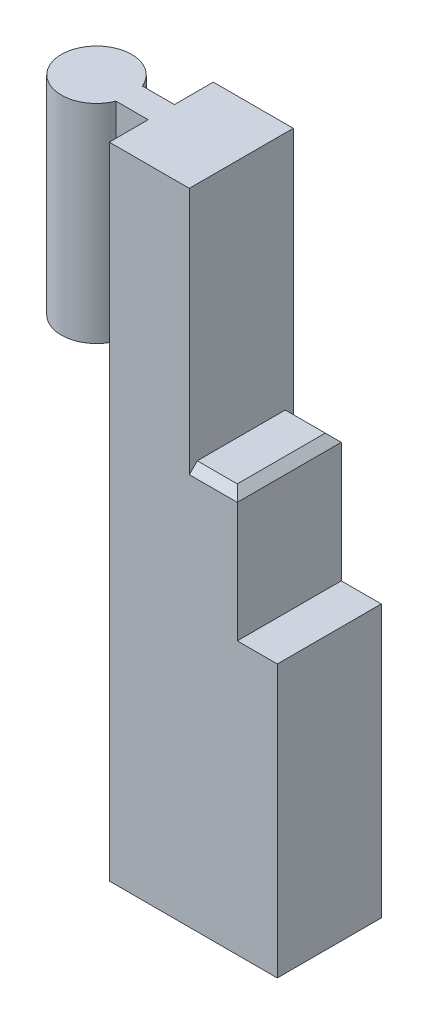
from build123d import *

# Parameters (mm, degrees)
SZKIC1_W                    = 10.5
SZKIC1_H                    = 40
DODANIE_WYCI_GNI_CIE1_DEPTH = 6.5
WYTNIJ_WYCI_GNI_CIE1_DEPTH  = 6.5
SFAZOWANIE1_SIZE            = 0.5
DODANIE_WYCI_GNI_CIE2_DEPTH = 13


with BuildPart() as part:
    # Szkic1 → Dodanie-wyciągnięcie1 (new body)
    with BuildSketch(Plane.XY):
        Rectangle(SZKIC1_W, SZKIC1_H)
    extrude(amount=DODANIE_WYCI_GNI_CIE1_DEPTH)

    # Szkic2 → Wytnij-wyciągnięcie1 (cut)
    with BuildSketch(Plane.XY.offset(6.5)):
        Polygon((5.25, 20), (-0.25, 20), (-0.25, 5), (2.75, 5), (2.75, -3), (5.25, -3), align=None)
    extrude(amount=-WYTNIJ_WYCI_GNI_CIE1_DEPTH, mode=Mode.SUBTRACT)

    # Sfazowanie1
    sfazowanie1_edges = [part.edges().sort_by_distance(p)[0] for p in [
        (1.25, 5, 0),
        (2.75, 5, 3.25),
        (1.25, 5, 6.5),
    ]]
    chamfer(sfazowanie1_edges, length=SFAZOWANIE1_SIZE)

    # Szkic3 → Dodanie-wyciągnięcie2 (add)
    with BuildSketch(Plane(origin=(0, 20, 0), x_dir=(1, 0, 0), z_dir=(0, 1, 0))):
        with BuildLine():
            Line((-7.258694583, -4.070409772), (-5.25, -4.070409772))
            Line((-5.25, -4.070409772), (-5.25, -2.429590228))
            Line((-5.25, -2.429590228), (-7.258694583, -2.429590228))
            ThreePointArc((-7.258694583, -2.429590228), (-11.5, -3.25), (-7.258694583, -4.070409772))
        make_face()
    extrude(amount=-DODANIE_WYCI_GNI_CIE2_DEPTH)


solid = part.part
